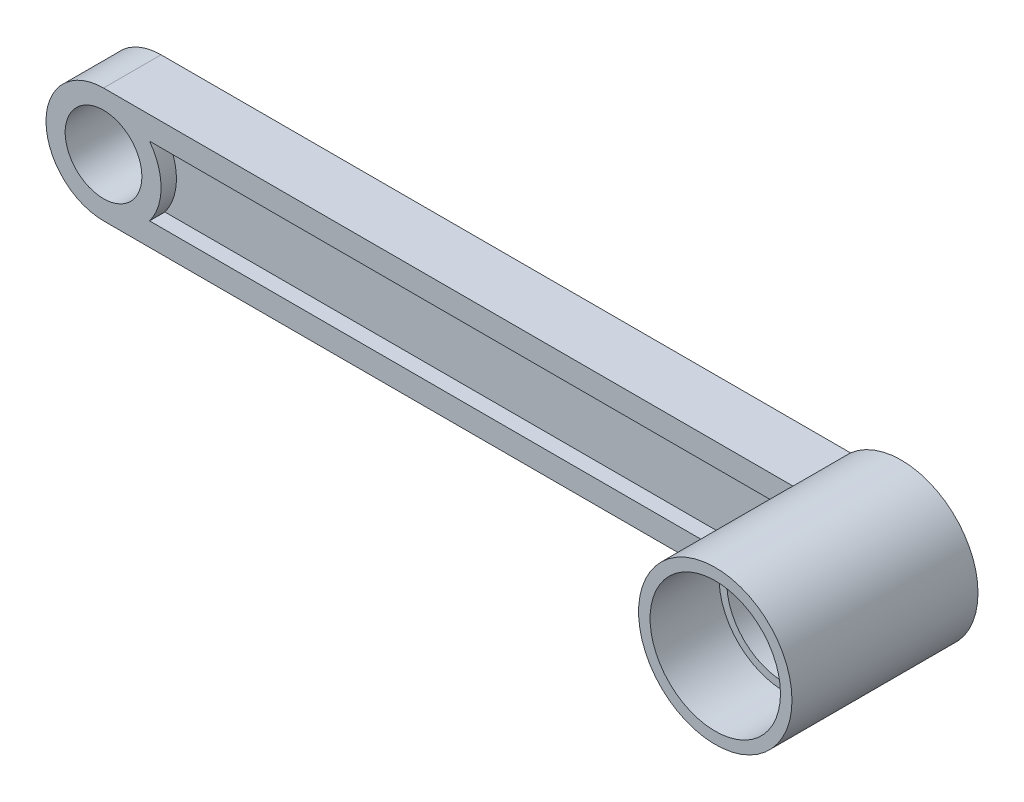
from build123d import *
from build123d.topology import SkipClean

# Parameters (mm, degrees)
EXTRUDE_1_DEPTH          = 48.25
EXTRUDE_1_DEPTH_BACK     = 48.25
EXTRUDE_2_DEPTH          = 3.75
EXTRUDE_2_DEPTH_BACK     = 3.75
SKETCH_2_R               = 7.5
SKETCH_2_R_2             = 5
CUT_EXTRUDE_1_DEPTH      = 3.75
CUT_EXTRUDE_1_DEPTH_BACK = 3.75
SKETCH_3_R               = 5
EXTRUDE_3_DEPTH          = 11.5
EXTRUDE_3_DEPTH_BACK     = 3.75
SKETCH_4_R               = 10
CUT_EXTRUDE_4_DEPTH      = 2
SKETCH_9_R               = 7.5
CUT_EXTRUDE_5_DEPTH      = 5
EXTRUDE_START            = 9
SKETCH_10_R              = 10
SKETCH_10_R_2            = 8.5
EXTRUDE_5_DEPTH          = 9
SKETCH_11_R              = 2.95
CUT_EXTRUDE_6_DEPTH      = 2
SKETCH_12_R              = 5.5
CUT_EXTRUDE_7_DEPTH      = 6
CUT_EXTRUDE_START        = -6
SKETCH_13_R              = 2.95
CUT_EXTRUDE_8_DEPTH      = 6


with BuildPart() as part:
    # 草图1 → 凸台-拉伸1 (new, two sides: drawn at the far end of the back side and taken through both)
    with BuildSketch(Plane(origin=(0, 0, 0), x_dir=(0, 0, -1), z_dir=(1, 0, 0)).offset(-EXTRUDE_1_DEPTH_BACK)):
        Polygon((3.75, 0), (3.75, 7.5), (-3.75, 7.5), (-3.75, -7.5), (3.75, -7.5), align=None)
    extrude(amount=EXTRUDE_1_DEPTH + EXTRUDE_1_DEPTH_BACK)

    # 草图2 → 凸台-拉伸2 (add, two sides: drawn at the far end of the back side and taken through both)
    with BuildSketch(Plane.XY.offset(-EXTRUDE_2_DEPTH_BACK)):
        with Locations((-48.25, 0)):
            Circle(SKETCH_2_R)
        with Locations((-48.25, 0)):
            Circle(SKETCH_2_R_2, mode=Mode.SUBTRACT)
    extrude(amount=EXTRUDE_2_DEPTH + EXTRUDE_2_DEPTH_BACK)

    # 草图3 → 切除-拉伸1 (cut, two sides: drawn at the far end of the back side and taken through both)
    with BuildSketch(Plane.XY.offset(-CUT_EXTRUDE_1_DEPTH_BACK)):
        with Locations((-48.25, 0)):
            Circle(SKETCH_3_R)
    extrude(amount=CUT_EXTRUDE_1_DEPTH + CUT_EXTRUDE_1_DEPTH_BACK, mode=Mode.SUBTRACT)

    # 草图4 → 凸台-拉伸3 (add, two sides: drawn at the far end of the back side and taken through both)
    with BuildSketch(Plane.XY.offset(-EXTRUDE_3_DEPTH_BACK)):
        with Locations((48.25, 0)):
            Circle(SKETCH_4_R)
    extrude(amount=EXTRUDE_3_DEPTH + EXTRUDE_3_DEPTH_BACK)

    # 草图8 → 切除-拉伸4 (cut)
    with BuildSketch(Plane.XY.offset(3.75)):
        with BuildLine():
            Line((0, 4.5), (-42.25, 4.5))
            ThreePointArc((-42.25, 4.5), (-40.75, 0), (-42.25, -4.5))
            Line((-42.25, -4.5), (0, -4.5))
            Line((0, -4.5), (39.31971445, -4.5))
            ThreePointArc((39.31971445, -4.5), (38.25, 0), (39.31971445, 4.5))
            Line((39.31971445, 4.5), (0, 4.5))
        make_face()
    extrude(amount=-CUT_EXTRUDE_4_DEPTH, mode=Mode.SUBTRACT)

    # 草图9 → 切除-拉伸5 (cut)
    with BuildSketch(Plane.XY.offset(11.5)):
        with Locations((48.25, 0)):
            Circle(SKETCH_9_R)
    extrude(amount=-CUT_EXTRUDE_5_DEPTH, mode=Mode.SUBTRACT)

    # 草图10 → 凸台-拉伸5 (add)
    with SkipClean():  # the faces are left unmerged after this step: merging them gives an invalid solid
        with BuildSketch(Plane.XY.offset(11.5).offset(EXTRUDE_START)):
            with Locations((48.25, 0)):
                Circle(SKETCH_10_R)
            with Locations((48.25, 0)):
                Circle(SKETCH_10_R_2, mode=Mode.SUBTRACT)
        extrude(amount=-EXTRUDE_5_DEPTH)

    # 草图11 → 切除-拉伸6 (cut)
    with SkipClean():  # the faces are left unmerged after this step: merging them gives an invalid solid
        with BuildSketch(Plane.XY.offset(6.5)):
            with Locations((48.25, 0)):
                Circle(SKETCH_11_R)
        extrude(amount=-CUT_EXTRUDE_6_DEPTH, mode=Mode.SUBTRACT)

    # 草图12 → 切除-拉伸7 (cut)
    with SkipClean():  # the faces are left unmerged after this step: merging them gives an invalid solid
        with BuildSketch(Plane(origin=(0, 0, -3.75), x_dir=(-1, 0, 0), z_dir=(0, 0, -1))):
            with Locations((-48.25, 0)):
                Circle(SKETCH_12_R)
        extrude(amount=-CUT_EXTRUDE_7_DEPTH, mode=Mode.SUBTRACT)

    # 草图13 → 切除-拉伸8 (cut)
    with SkipClean():  # the faces are left unmerged after this step: merging them gives an invalid solid
        with BuildSketch(Plane(origin=(0, 0, 2.25), x_dir=(-1, 0, 0), z_dir=(0, 0, -1)).offset(CUT_EXTRUDE_START)):
            with Locations((-48.25, 0)):
                Circle(SKETCH_13_R)
        extrude(amount=CUT_EXTRUDE_8_DEPTH, mode=Mode.SUBTRACT)


solid = part.part
